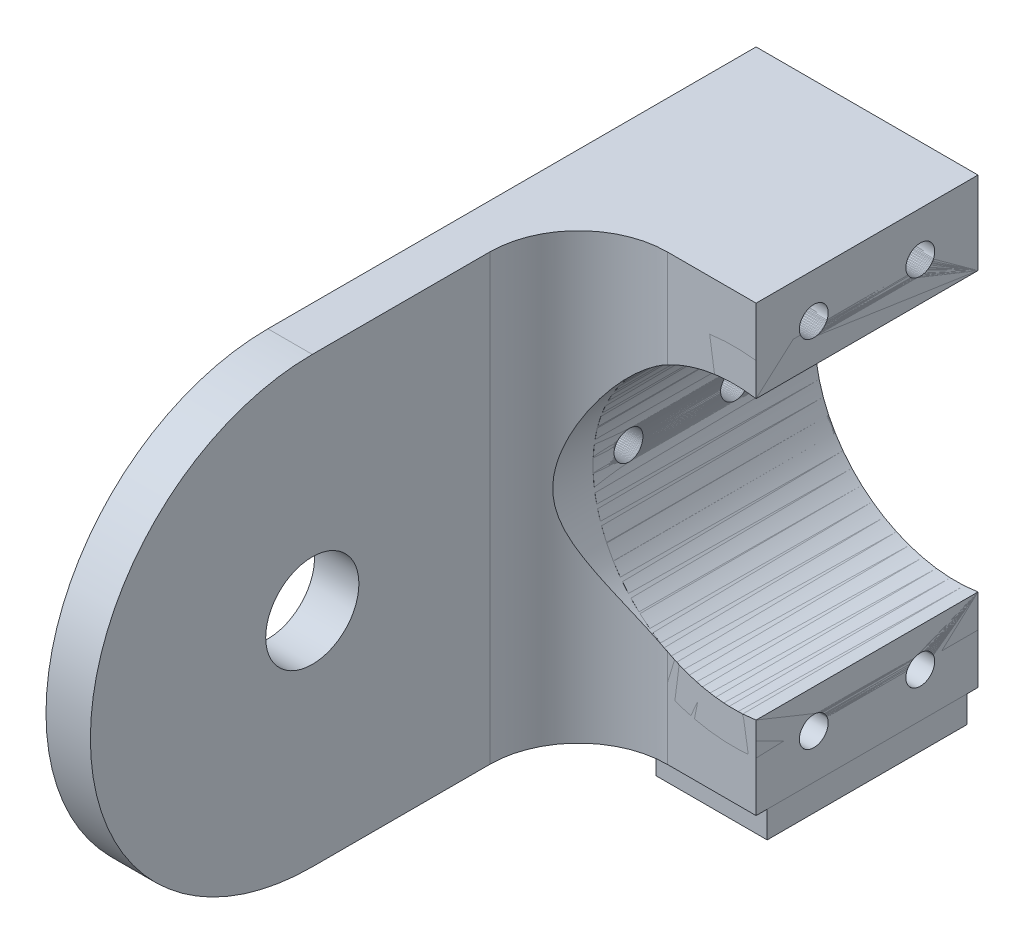
from build123d import *

# Parameters (mm, degrees)
CENTRE_HOLE_FOR_L2_DEPTH      = 40
CENTRE_HOLE_FOR_L2_DEPTH_BACK = 10
SKETCH1_R                     = 39.1
SKETCH1_R_2                   = 31.75
MAIN_STRUCTURE_DEPTH          = 60
MAIN_STRUCTURE_DEPTH_BACK     = 50
SKETCH2_W                     = 90
SKETCH2_H                     = 100
SKETCH2_R                     = 31.75
BEARING_CURVE_DEPTH           = 10
SKETCH6_R                     = 10.5
SHAFT_HOLE_DEPTH              = 10
WRIST_CUTOUT_DEPTH            = 186.809041761
SURFACECUT1_START             = 5
SURFACECUT1_OUTLINE_R         = 10.5
SURFACECUT1_DEPTH             = 40
SKETCH13_W                    = 25
SKETCH13_H                    = 45
SKETCH13_R                    = 2.525
BOSS_EXTRUDE1_DEPTH           = 6
SKETCH14_R                    = 3.25
CUT_EXTRUDE2_DEPTH            = 168.7378908
SKETCH15_R                    = 3.25
CUT_EXTRUDE3_DEPTH            = 168.7378908


# Read off the part's stored shape, not the designer's step: SurfaceCut1
with BuildPart() as part:
    # Sketch1 → Centre Hole for L2 (new, two sides: drawn at the far end of the back side and taken through both)
    with BuildSketch(Plane.XY.offset(-CENTRE_HOLE_FOR_L2_DEPTH_BACK)):
        Circle(SKETCH1_R)
        Circle(SKETCH1_R_2, mode=Mode.SUBTRACT)
    extrude(amount=CENTRE_HOLE_FOR_L2_DEPTH + CENTRE_HOLE_FOR_L2_DEPTH_BACK)


with BuildPart() as body_2:
    # Sketch2 → Main Structure (new, two sides: drawn at the far end of the back side and taken through both)
    with BuildSketch(Plane.XY.offset(40).offset(-MAIN_STRUCTURE_DEPTH_BACK)):
        Rectangle(SKETCH2_W, SKETCH2_H)
        Circle(SKETCH2_R, mode=Mode.SUBTRACT)
    extrude(amount=MAIN_STRUCTURE_DEPTH + MAIN_STRUCTURE_DEPTH_BACK)

    # Sketch3 → Bearing Curve (add)
    with BuildSketch(Plane.ZY.offset(45)):
        with BuildLine():
            Line((100, 50), (100, -50))
            ThreePointArc((100, -50), (150, 0), (100, 50))
        make_face()
    bearing_curve = extrude(amount=-BEARING_CURVE_DEPTH)

    # Upright Mirror: Bearing Curve across plane
    add(bearing_curve.mirror(Plane(origin=(0, 0, 0), x_dir=(0, 0, 1), z_dir=(1, 0, 0))))

    # Sketch6 → Shaft Hole (cut)
    with BuildSketch(Plane.ZY.offset(45)):
        with Locations((100, 0)):
            Circle(SKETCH6_R)
    shaft_hole = extrude(amount=-SHAFT_HOLE_DEPTH, mode=Mode.SUBTRACT)

    # Sketch4 → Wrist Cutout (cut, through all)
    with BuildSketch(Plane(origin=(0, 50, 0), x_dir=(1, 0, 0), z_dir=(0, 1, 0))):
        with BuildLine():
            Line((-35, -100), (-35, -60))
            ThreePointArc((-35, -60), (-29.142135624, -45.857864376), (-15, -40))
            Line((-15, -40), (15, -40))
            ThreePointArc((15, -40), (29.142135624, -45.857864376), (35, -60))
            Line((35, -60), (35, -100))
            Line((35, -100), (-35, -100))
        make_face()
    extrude(amount=-WRIST_CUTOUT_DEPTH, mode=Mode.SUBTRACT)

    # Bearing Mirror: Shaft Hole across plane
    add(shaft_hole.mirror(Plane(origin=(0, 0, 0), x_dir=(0, 0, 1), z_dir=(1, 0, 0))), mode=Mode.SUBTRACT)


with BuildPart() as surfacecut1_tool:
    # SurfaceCut1 outline → SurfaceCut1 (new body)
    with BuildSketch(Plane.YZ.offset(SURFACECUT1_START)):
        with BuildLine():
            ThreePointArc((50, 100), (0, 150), (-50, 100))
            Line((-50, 100), (-50, -10))
            Line((-50, -10), (50, -10))
            Line((50, -10), (50, 100))
        make_face()
        with Locations((0, 100)):
            Circle(SURFACECUT1_OUTLINE_R, mode=Mode.SUBTRACT)
    extrude(amount=SURFACECUT1_DEPTH)


with BuildPart() as part_1:
    add(part.part)

    # SurfaceCut1: cut by surfacecut1_tool
    add(surfacecut1_tool.part, mode=Mode.SUBTRACT)


with BuildPart() as body_2_1:
    add(body_2.part)

    # SurfaceCut1: cut by surfacecut1_tool
    add(surfacecut1_tool.part, mode=Mode.SUBTRACT)


with BuildPart() as body_3:
    # Sketch13 → Boss-Extrude1 (new body)
    with BuildSketch(Plane(origin=(0, -50, 0), x_dir=(-1, 0, 0), z_dir=(0, -1, 0))):
        with Locations((7.5, -15)):
            Rectangle(SKETCH13_W, SKETCH13_H)
        with Locations(Location((14, -31, 0), (0, 0, 90))):
            Circle(SKETCH13_R, mode=Mode.SUBTRACT)
        with Locations(Location((14, 1, 0), (0, 0, 90))):
            Circle(SKETCH13_R, mode=Mode.SUBTRACT)
    extrude(amount=BOSS_EXTRUDE1_DEPTH)


with BuildPart() as cut_extrude2_tool:
    # Sketch14 → Cut-Extrude2 (new, through all)
    with BuildSketch(Plane.ZY.offset(45)):
        with Locations((8, 0)):
            Circle(SKETCH14_R)
        with Locations((32, 0)):
            Circle(SKETCH14_R)
    extrude(amount=-CUT_EXTRUDE2_DEPTH)


with BuildPart() as part_2:
    add(part_1.part)

    # Cut-Extrude2: cut by cut_extrude2_tool
    add(cut_extrude2_tool.part, mode=Mode.SUBTRACT)


with BuildPart() as body_2_2:
    add(body_2_1.part)

    # Cut-Extrude2: cut by cut_extrude2_tool
    add(cut_extrude2_tool.part, mode=Mode.SUBTRACT)


with BuildPart() as cut_extrude3_tool:
    # Sketch15 → Cut-Extrude3 (new, through all)
    with BuildSketch(Plane.ZY.offset(45)):
        with Locations((32, 0)):
            Circle(SKETCH15_R)
        with Locations((8, 0)):
            Circle(SKETCH15_R)
        with Locations((3, 40)):
            Circle(SKETCH15_R)
        with Locations((27, 40)):
            Circle(SKETCH15_R)
        with Locations((3, -40)):
            Circle(SKETCH15_R)
        with Locations((27, -40)):
            Circle(SKETCH15_R)
    extrude(amount=-CUT_EXTRUDE3_DEPTH)


with BuildPart() as part_3:
    add(part_2.part)

    # Cut-Extrude3: cut by cut_extrude3_tool
    add(cut_extrude3_tool.part, mode=Mode.SUBTRACT)


with BuildPart() as body_2_3:
    add(body_2_2.part)

    # Cut-Extrude3: cut by cut_extrude3_tool
    add(cut_extrude3_tool.part, mode=Mode.SUBTRACT)


solid = Compound([body_3.part, part_3.part, body_2_3.part])
